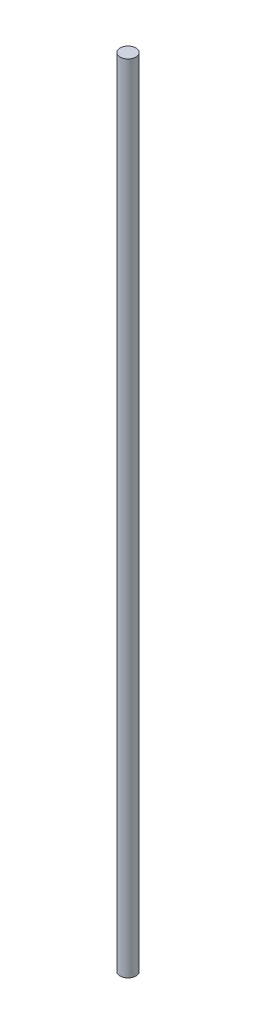
from build123d import *

# Parameters (mm, degrees)
SKETCH1_R           = 4
BOSS_EXTRUDE1_DEPTH = 200


with BuildPart() as part:
    # Sketch1 → Boss-Extrude1 (new, symmetric)
    with BuildSketch(Plane(origin=(0, 0, 0), x_dir=(1, 0, 0), z_dir=(0, 1, 0))):
        Circle(SKETCH1_R)
    extrude(amount=BOSS_EXTRUDE1_DEPTH, both=True)


solid = part.part
